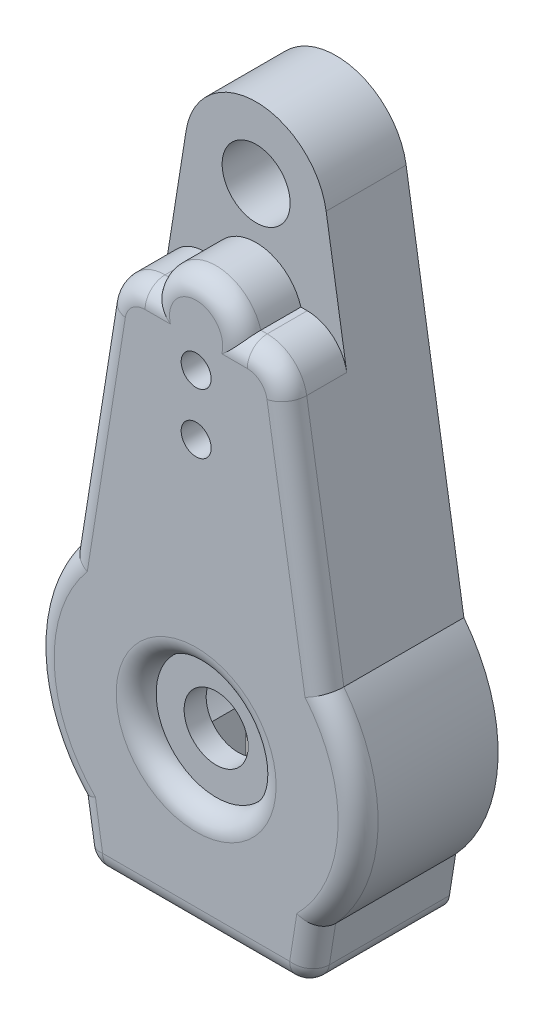
from build123d import *

# Parameters (mm, degrees)
SKETCH1_R                = 1.7
BOSS_EXTRUDE4_DEPTH      = 4
BOSS_EXTRUDE6_DEPTH      = 3
BOSS_EXTRUDE6_DEPTH_BACK = 0.1
SKETCH1_9_R              = 0.749999999999988
SKETCH1_9_R_2            = 0.749999999999991
SKETCH1_9_R_3            = 1.6
FILLET2_R                = 1
FILLET3_R                = 2
SKETCH2_R                = 4
CUT_EXTRUDE1_DEPTH       = 1
SKETCH3_R                = 3.0000000000000004
CUT_EXTRUDE2_DEPTH       = 1
FILLET4_R                = 1
FILLET5_R                = 1


# Some blends are built 0.0001 mm under size
with BuildPart() as part:
    # Sketch1 → Boss-Extrude4 (new body)
    with BuildSketch(Plane.XY):
        with BuildLine():
            Line((-3.5013415582545715, 23.136685369325342), (-6.388076465833109, 4.9802087372588275))
            ThreePointArc((-6.388076465833109, 4.9802087372588275), (-8.093690123038968, -0.31965636583910695), (-5.975409836065571, -5.468498632261951))
            Line((-5.9754098360655705, -5.468498632261951), (-5.531546482610164, -8.2602321522629))
            Line((-5.531546482610164, -8.2602321522629), (-4.5, -8.2602321522629))
            Line((-4.499999999999999, -8.2602321522629), (-4.500000000000003, -4.1182520563948))
            ThreePointArc((-4.500000000000003, -4.1182520563948), (-6.1, -6.7e-16), (-4.500000000000001, 4.118252056394799))
            Line((-4.5, 4.118252056394798), (-4.500000000000003, 10.602053391322137))
            Line((-4.500000000000003, 10.602053391322137), (-2.23677055895614, 18.353113855252126))
            ThreePointArc((-2.236770558956141, 18.353113855252126), (5.33e-15, 20.030171719280638), (2.2367705589561506, 18.353113855252126))
            Line((2.2367705589561497, 18.353113855252126), (4.499999999999999, 10.602053391322137))
            Line((4.499999999999999, 10.602053391322137), (4.500000000000003, 4.1182520563948))
            ThreePointArc((4.5000000000000036, 4.1182520563948), (6.099999999999998, -2.2e-16), (4.5, -4.118252056394798))
            Line((4.5, -4.118252056394798), (4.500000000000001, -8.260232152262898))
            Line((4.500000000000001, -8.2602321522629), (5.531546482610164, -8.2602321522629))
            Line((5.531546482610164, -8.2602321522629), (5.975409836065575, -5.468498632261945))
            ThreePointArc((5.975409836065576, -5.468498632261946), (8.093690123038972, -0.3196563658391036), (6.388076465833111, 4.9802087372588275))
            Line((6.388076465833109, 4.9802087372588275), (3.5013415582545715, 23.136685369325342))
            ThreePointArc((3.5013415582545715, 23.136685369325342), (-1.1e-16, 26.125319634106553), (-3.5013415582545715, 23.136685369325342))
        make_face()
        with Locations((0, 22.58)):
            Circle(SKETCH1_R, mode=Mode.SUBTRACT)
    extrude(amount=-BOSS_EXTRUDE4_DEPTH)

    # Sketch1<9> → Boss-Extrude6 (add, two sides: drawn at the far end of the back side and taken through both)
    with BuildSketch(Plane.XY.offset(-BOSS_EXTRUDE6_DEPTH_BACK)):
        with BuildLine():
            Line((-2.2367705589561404, 18.353113855252126), (-4.261891259190779, 18.353113855252126))
            Line((-4.261891259190779, 18.353113855252126), (-6.388076465833109, 4.9802087372588275))
            ThreePointArc((-6.388076465833109, 4.9802087372588275), (-8.093690123038968, -0.31965636583910695), (-5.975409836065571, -5.468498632261951))
            Line((-5.9754098360655705, -5.468498632261951), (-5.531546482610164, -8.2602321522629))
            Line((-5.531546482610164, -8.2602321522629), (5.531546482610164, -8.2602321522629))
            Line((5.531546482610164, -8.2602321522629), (5.975409836065575, -5.468498632261945))
            ThreePointArc((5.975409836065576, -5.468498632261946), (8.093690123038972, -0.3196563658391036), (6.388076465833111, 4.9802087372588275))
            Line((6.388076465833109, 4.9802087372588275), (4.261891259190779, 18.353113855252126))
            Line((4.261891259190779, 18.353113855252126), (2.2367705589561506, 18.353113855252126))
            ThreePointArc((2.2367705589561506, 18.353113855252126), (5.33e-15, 20.030171719280638), (-2.236770558956141, 18.353113855252126))
        make_face()
        with Locations((5.15e-15, 16)):
            Circle(SKETCH1_9_R, mode=Mode.SUBTRACT)
        with Locations((4.18e-15, 13.000000000000002)):
            Circle(SKETCH1_9_R_2, mode=Mode.SUBTRACT)
        Circle(SKETCH1_9_R_3, mode=Mode.SUBTRACT)
    extrude(amount=BOSS_EXTRUDE6_DEPTH + BOSS_EXTRUDE6_DEPTH_BACK)

    # Fillet2
    fillet2_edges = [part.edges().sort_by_distance(p)[0] for p in [
        (5.531546482610164, -8.2602321522629, -0.5),
        (-5.531546482610164, -8.2602321522629, -0.5),
        (0, -8.2602321522629, 3),
        (5.753478159337869, -6.864365392262423, 3),
        (-8.093690123038968, -0.3196563658391076, 3),
        (-5.324983862511944, 11.666661296255477, 3),
        (-3.2493309090734597, 18.353113855252126, 3),
        (3.249330909073465, 18.353113855252126, 3),
        (5e-15, 20.030171719280638, 3),
        (-5.753478159337868, -6.864365392262425, 3),
        (8.093690123038972, -0.31965636583910384, 3),
        (5.324983862511944, 11.666661296255477, 3),
    ]]
    fillet(fillet2_edges, radius=FILLET2_R)

    # Fillet3
    # the kernel refuses this fillet: 2 mm, written as the material it takes off along each edge
    with BuildSketch(Plane(origin=(-2.554754600251938, 16.35311385525213, 3), x_dir=(0, 1, 0), z_dir=(1, 0, 0))) as fillet3_piece_1:
        with BuildLine():
            CenterArc((1, -1), 1, 0, 90)
            Line((2, -1), (2, 0))
            Line((2, 0), (1, 0))
        make_face()
    revolve(axis=Axis((-2.554754600251938, 16.35311385525213, 3), (0, 0, 1)), revolution_arc=80.96604330855703, mode=Mode.SUBTRACT)
    with BuildSketch(Plane(origin=(2.554754600251939, 16.35311385525213, 3), x_dir=(0.9875954553070736, 0.15701979702194924, 0), z_dir=(0.15701979702194924, -0.9875954553070736, 0))) as fillet3_piece_2:
        with BuildLine():
            CenterArc((1, -1), 1, 0, 90)
            Line((2, -1), (2, 0))
            Line((2, 0), (1, 0))
        make_face()
    revolve(axis=Axis((2.554754600251939, 16.35311385525213, 3), (0, 0, 1)), revolution_arc=80.96604330855705, mode=Mode.SUBTRACT)
    with BuildSketch(Plane(origin=(4.261891259190781, 18.353113855252126, 3), x_dir=(0.15701979702194913, -0.9875954553070736, 0), z_dir=(0, 0, -1))) as fillet3_piece_3:
        with BuildLine():
            CenterArc((FILLET3_R * 0.853568329469, FILLET3_R), FILLET3_R, 189.03395669144297, 80.96604330855706)
            Line((-FILLET3_R * 0.134027125838, FILLET3_R * 0.842980202978), (0, 0))
            Line((0, 0), (FILLET3_R * 0.853568329469, -3e-17))
        make_face()
    extrude(amount=3, mode=Mode.SUBTRACT)
    with BuildSketch(Plane(origin=(-4.261891259190779, 18.353113855252126, 0), x_dir=(-0.15701979702194965, -0.9875954553070736, 0), z_dir=(0, 0, 1))) as fillet3_piece_4:
        with BuildLine():
            CenterArc((FILLET3_R * 0.853568329469, FILLET3_R), FILLET3_R, 189.033956691443, 80.96604330855706)
            Line((-FILLET3_R * 0.134027125838, FILLET3_R * 0.842980202978), (0, 0))
            Line((0, 0), (FILLET3_R * 0.853568329469, -3e-17))
        make_face()
    extrude(amount=3.000000000000001, mode=Mode.SUBTRACT)

    # Sketch2 → Cut-Extrude1 (cut)
    with BuildSketch(Plane(origin=(0, 0, -0.1), x_dir=(-1, 0, 0), z_dir=(0, 0, -1))):
        Circle(SKETCH2_R)
    extrude(amount=-CUT_EXTRUDE1_DEPTH, mode=Mode.SUBTRACT)

    # Sketch3 → Cut-Extrude2 (cut)
    with BuildSketch(Plane.XY.offset(3)):
        Circle(SKETCH3_R)
    extrude(amount=-CUT_EXTRUDE2_DEPTH, mode=Mode.SUBTRACT)

    # Fillet4
    fillet4_edges = [part.edges().sort_by_distance(p)[0] for p in [
        (4, 4.9e-16, 0.9),
    ]]
    fillet(fillet4_edges, radius=FILLET4_R - 0.0001)  # a hair under: the kernel refuses the full size

    # Fillet5
    fillet5_edges = [part.edges().sort_by_distance(p)[0] for p in [
        (-3.0000000000000004, 3.7e-16, 3),
    ]]
    fillet(fillet5_edges, radius=FILLET5_R - 0.0001)  # a hair under: the kernel refuses the full size


solid = part.part
